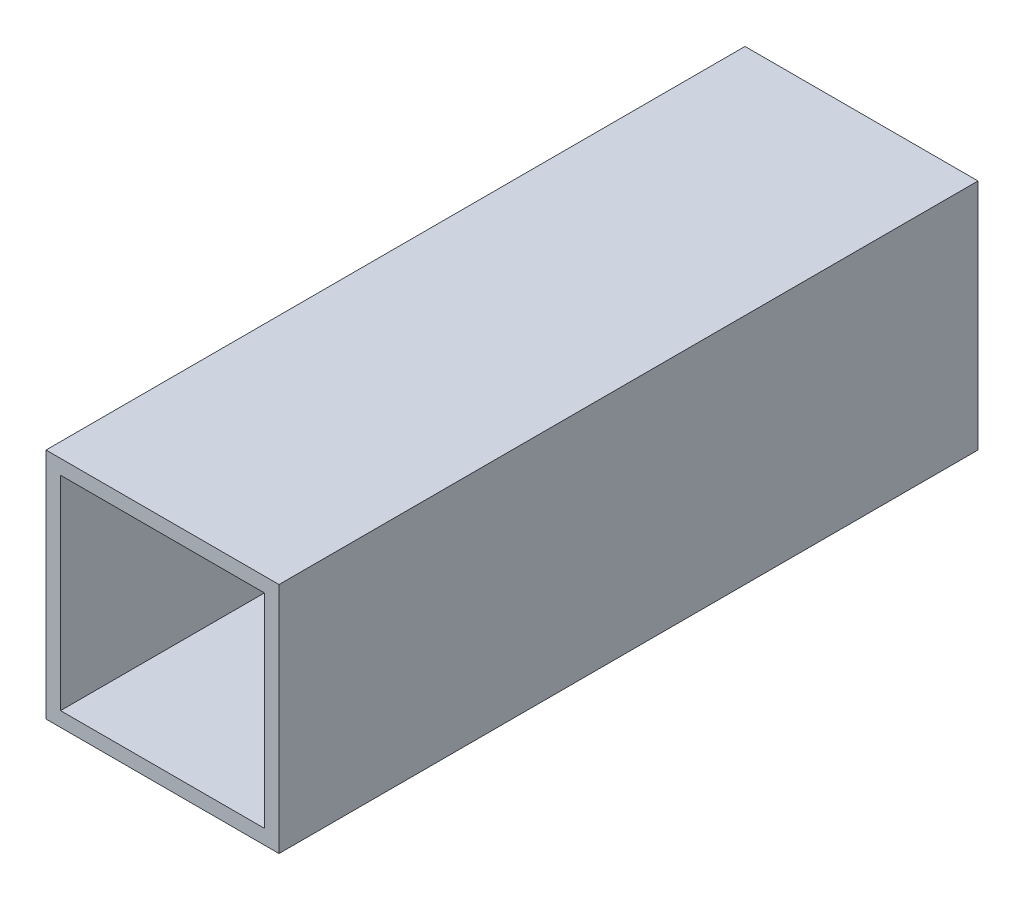
from build123d import *

# Parameters (mm, degrees)
SKETCH1_W           = 25.4
SKETCH1_H           = 25.4
BOSS_EXTRUDE1_DEPTH = 38.1
SHELL1_T            = -1.5875


with BuildPart() as part:
    # Sketch1 → Boss-Extrude1 (new, symmetric)
    with BuildSketch(Plane.XY):
        Rectangle(SKETCH1_W, SKETCH1_H)
    extrude(amount=BOSS_EXTRUDE1_DEPTH, both=True)

    # Shell1
    shell1_openings = [part.faces().sort_by_distance(p)[0] for p in [
        (0, 0, -38.1),
        (0, 0, 38.1),
    ]]
    offset(amount=SHELL1_T, openings=shell1_openings, kind=Kind.INTERSECTION)


solid = part.part
